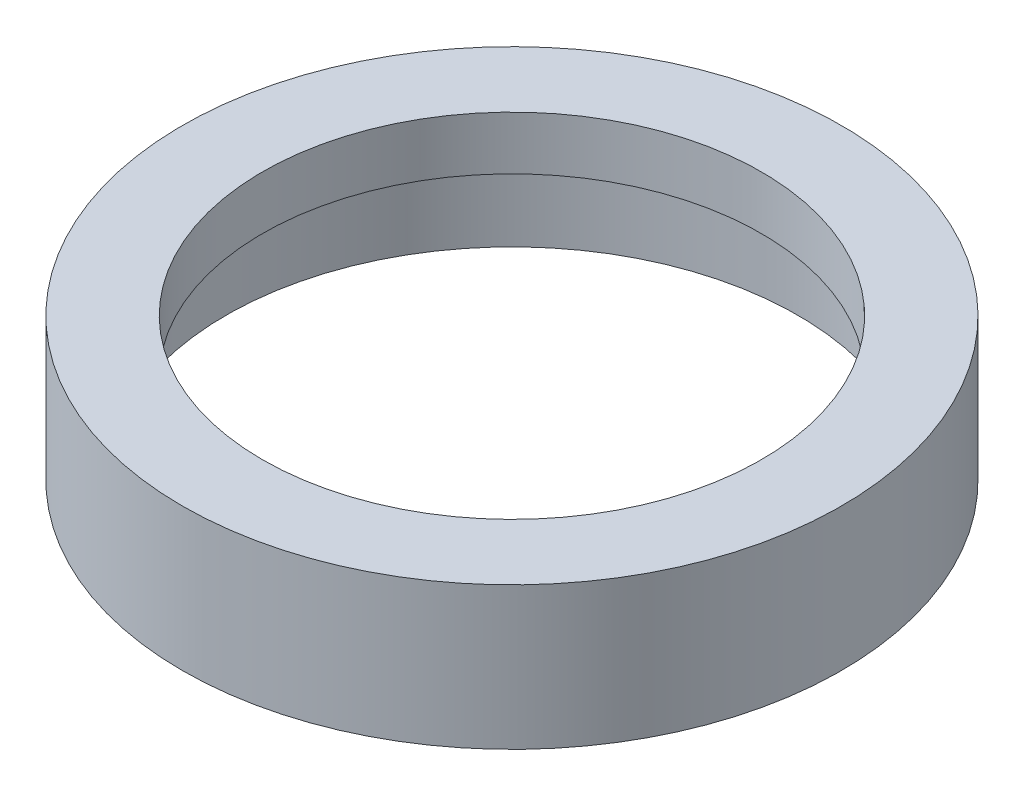
from build123d import *

# Parameters (mm, degrees)
SKETCH2_R           = 18.5
SKETCH2_R_2         = 16.05
BOSS_EXTRUDE1_DEPTH = 5
SKETCH3_R           = 18.5
SKETCH3_R_2         = 14
BOSS_EXTRUDE2_DEPTH = 3


with BuildPart() as part:
    # Sketch2 → Boss-Extrude1 (new body)
    with BuildSketch(Plane(origin=(0, 9, 0), x_dir=(1, 0, 0), z_dir=(0, 1, 0))):
        with Locations((-0.5, 0)):
            Circle(SKETCH2_R)
        with Locations((-0.5, 0)):
            Circle(SKETCH2_R_2, mode=Mode.SUBTRACT)
    extrude(amount=BOSS_EXTRUDE1_DEPTH)

    # Sketch3 → Boss-Extrude2 (add)
    with BuildSketch(Plane(origin=(0, 14, 0), x_dir=(1, 0, 0), z_dir=(0, 1, 0))):
        with Locations((-0.5, 0)):
            Circle(SKETCH3_R)
        with Locations((-0.5, 0)):
            Circle(SKETCH3_R_2, mode=Mode.SUBTRACT)
    extrude(amount=BOSS_EXTRUDE2_DEPTH)


solid = part.part
